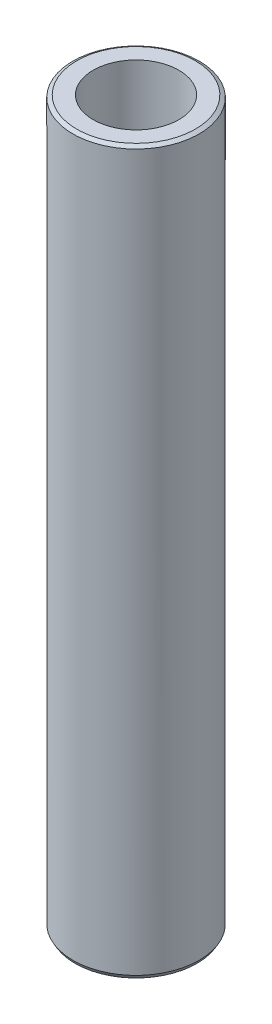
from build123d import *
from OCP.BRepFilletAPI import BRepFilletAPI_MakeChamfer

# Parameters (mm, degrees)
SKETCH1_R           = 52.5
BOSS_EXTRUDE1_DEPTH = 600
SKETCH2_R           = 35.647579847
CUT_EXTRUDE1_DEPTH  = 605.576297914
CHAMFER1_SIZE       = 1.84973773
CHAMFER1_SIZE2      = 3.203839728


with BuildPart() as part:
    # Sketch1 → Boss-Extrude1 (new body)
    with BuildSketch(Plane(origin=(0, 0, 0), x_dir=(1, 0, 0), z_dir=(0, 1, 0))):
        Circle(SKETCH1_R)
    extrude(amount=BOSS_EXTRUDE1_DEPTH)

    # Sketch2 → Cut-Extrude1 (cut, through all)
    with BuildSketch(Plane(origin=(0, 0, 0), x_dir=(1, 0, 0), z_dir=(0, 1, 0))):
        Circle(SKETCH2_R)
    extrude(amount=CUT_EXTRUDE1_DEPTH, mode=Mode.SUBTRACT)

    # Chamfer1: one chamfer whose edges measure the first distance from different faces: ONE call of the kernel's chamfer builder (chamfer() names one face for all edges)
    chamfer1_edges_1 = [part.edges().sort_by_distance(p)[0] for p in [
        (-52.5, 600, 0),
    ]]
    chamfer1_side_1 = [part.faces().sort_by_distance(p)[0] for p in [
        (-52.5, 300, 0),
    ]]
    chamfer1_edges_2 = [part.edges().sort_by_distance(p)[0] for p in [
        (-52.5, 0, 0),
    ]]
    chamfer1_side_2 = [part.faces().sort_by_distance(p)[0] for p in [
        (-51.01507576, 0, 0),
    ]]
    chamfer1 = BRepFilletAPI_MakeChamfer(part.part.solid().wrapped)
    for e in chamfer1_edges_1:
        chamfer1.Add(CHAMFER1_SIZE, CHAMFER1_SIZE2, e.wrapped, chamfer1_side_1[0].wrapped)  # the first distance lies on this face
    for e in chamfer1_edges_2:
        chamfer1.Add(CHAMFER1_SIZE, CHAMFER1_SIZE2, e.wrapped, chamfer1_side_2[0].wrapped)  # the first distance lies on this face
    add(Compound.cast(chamfer1.Shape()), mode=Mode.REPLACE)


solid = part.part
